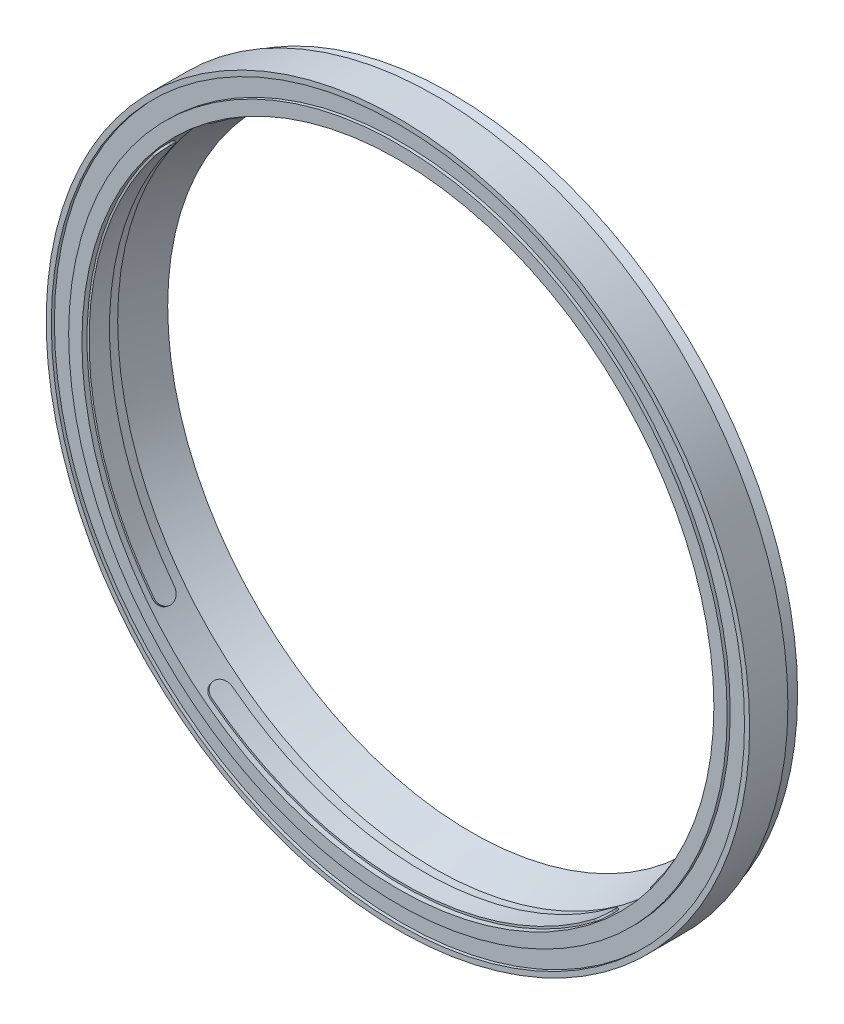
from build123d import *

# Parameters (mm, degrees)
BOSS_EXTRUDE1_DEPTH      = 2
FILLET1_R                = 1
CIRPATTERN1_COUNT        = 4
FILLET1_OF_CIRPATTERN1_R = 1


with BuildPart() as part:
    # Sketch1 → Revolve1 (revolve)
    with BuildSketch(Plane(origin=(0, 0, 0), x_dir=(0, 0, -1), z_dir=(1, 0, 0)), mode=Mode.PRIVATE) as revolve1_sk:
        with BuildLine():
            Line((3.75, 34.45), (3.75, 33.95))
            Line((3.75, 33.95), (3.75, 33.160815003))
            Line((3.75, 33.160815003), (5.2, 33.95))
            Line((5.2, 33.95), (5.2, 33.039184997))
            Line((5.2, 33.039184997), (3.906327923, 32.335083898))
            ThreePointArc((3.906327923, 32.335083898), (3.854141696, 32.248597283), (3.903979583, 32.160736474))
            Line((3.903979583, 32.160736474), (7.2, 30.25))
            Line((7.2, 30.25), (7.2, 29.75))
            Line((7.2, 29.75), (3.5, 30.95))
            Line((3.5, 30.95), (0, 30.95))
            Line((0, 30.95), (0, 32.25))
            Line((0, 32.25), (0.3, 32.25))
            Line((0.3, 32.25), (0.3, 33.95))
            Line((0.3, 33.95), (0, 33.95))
            Line((0, 33.95), (0, 34.45))
            Line((0, 34.45), (3.75, 34.45))
        make_face()
    revolve(revolve1_sk.sketch.rotate(Axis((0, 0, 0), (0, 0, -1)), 90), axis=Axis((0, 0, 0), (0, 0, -1)))

    # Sketch2 → Boss-Extrude1 (add)
    with BuildSketch(Plane.XY.offset(-0.5)):
        with BuildLine():
            Line((-19.502212389, 23.774486575), (-21.5, 26.209921785))
            ThreePointArc((-21.5, 26.209921785), (0, 33.9), (21.5, 26.209921785))
            Line((21.5, 26.209921785), (19.502212389, 23.774486575))
            ThreePointArc((19.502212389, 23.774486575), (0, 30.75), (-19.502212389, 23.774486575))
        make_face()
    boss_extrude1 = extrude(amount=-BOSS_EXTRUDE1_DEPTH)

    # Fillet1
    fillet1_edges = [part.edges().sort_by_distance(p)[0] for p in [
        (-19.565634218, 23.851801979, -2.5),
        (-19.565634218, 23.851801979, -0.5),
        (19.565634218, 23.851801979, -2.5),
        (19.565634218, 23.851801979, -0.5),
    ]]
    fillet(fillet1_edges, radius=FILLET1_R - 0.0001)  # a hair under: the kernel refuses the full size

    # CirPattern1: Boss-Extrude1 ×4 about axis
    cirpattern1_axis = Axis((0, 0, 0), (0, 0, 1))
    for i in range(1, CIRPATTERN1_COUNT):
        add(boss_extrude1.rotate(cirpattern1_axis, i * 360 / CIRPATTERN1_COUNT))

    # Fillet1 of CirPattern1
    fillet1_of_cirpattern1_edges = [part.edges().sort_by_distance(p)[0] for p in [
        (-23.851801979, -19.565634218, -2.5),
        (-23.851801979, -19.565634218, -0.5),
        (-23.851801979, 19.565634218, -2.5),
        (-23.851801979, 19.565634218, -0.5),
        (19.565634218, -23.851801979, -2.5),
        (19.565634218, -23.851801979, -0.5),
        (-19.565634218, -23.851801979, -2.5),
        (-19.565634218, -23.851801979, -0.5),
        (23.851801979, 19.565634218, -2.5),
        (23.851801979, 19.565634218, -0.5),
        (23.851801979, -19.565634218, -2.5),
        (23.851801979, -19.565634218, -0.5),
    ]]
    fillet(fillet1_of_cirpattern1_edges, radius=FILLET1_OF_CIRPATTERN1_R - 0.0001)  # a hair under: the kernel refuses the full size


solid = part.part
